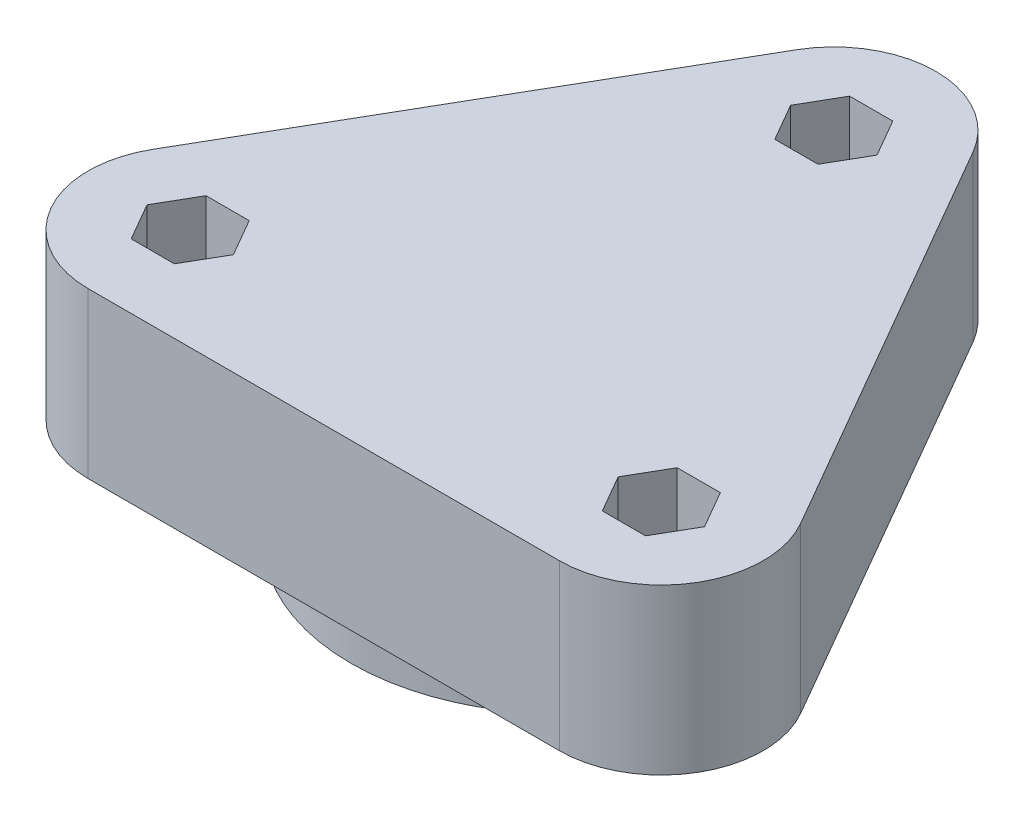
from build123d import *

# Parameters (mm, degrees)
ESQUISSE1_R             = 11.9
ESQUISSE1_R_2           = 2
BOSS_EXTRU_1_DEPTH      = 12
ENL_V_MAT_EXTRU_1_DEPTH = 5
SKETCH1_R               = 11.9
BOSS_EXTRUDE1_DEPTH     = 4
BOSS_EXTRUDE2_START     = 4.1
SKETCH2_R               = 15.5
SKETCH2_R_2             = 11.9
BOSS_EXTRUDE2_DEPTH     = 4.1
BOSS_EXTRUDE3_DEPTH     = 0.1


with BuildPart() as part:
    # Esquisse1 → Boss.-Extru.1 (new body)
    with BuildSketch(Plane(origin=(0, 0, 0), x_dir=(1, 0, 0), z_dir=(0, 1, 0))):
        with BuildLine():
            Line((-6.495190528, 23.75), (-23.815698604, -6.25))
            ThreePointArc((-23.815698604, -6.25), (-23.815698604, -13.75), (-17.320508076, -17.5))
            Line((-17.320508076, -17.5), (17.320508076, -17.5))
            ThreePointArc((17.320508076, -17.5), (23.815698604, -13.75), (23.815698604, -6.25))
            Line((23.815698604, -6.25), (6.495190528, 23.75))
            ThreePointArc((6.495190528, 23.75), (0, 27.5), (-6.495190528, 23.75))
        make_face()
        Circle(ESQUISSE1_R, mode=Mode.SUBTRACT)
        with Locations((-17.320508076, -10)):
            Circle(ESQUISSE1_R_2, mode=Mode.SUBTRACT)
        with Locations((0, 20)):
            Circle(ESQUISSE1_R_2, mode=Mode.SUBTRACT)
        with Locations((17.320508076, -10)):
            Circle(ESQUISSE1_R_2, mode=Mode.SUBTRACT)
    extrude(amount=BOSS_EXTRU_1_DEPTH)

    # Esquisse2 → Enlèv. mat.-Extru.1 (cut)
    with BuildSketch(Plane(origin=(0, 12, 0), x_dir=(1, 0, 0), z_dir=(0, 1, 0))):
        Polygon((-18.908221316, -7.25), (-20.495934556, -10), (-18.908221316, -12.75), (-15.732794835, -12.75), (-14.145081595, -10), (-15.732794835, -7.25), align=None)
        Polygon((-1.58771324, 22.75), (-3.175426481, 20), (-1.58771324, 17.25), (1.58771324, 17.25), (3.175426481, 20), (1.58771324, 22.75), align=None)
        Polygon((18.908221316, -7.25), (15.732794835, -7.25), (14.145081595, -10), (15.732794835, -12.75), (18.908221316, -12.75), (20.495934556, -10), align=None)
    extrude(amount=-ENL_V_MAT_EXTRU_1_DEPTH, mode=Mode.SUBTRACT)

    # Sketch2 → Boss-Extrude2 (add)
    with BuildSketch(Plane.XZ.offset(BOSS_EXTRUDE2_START)):
        Circle(SKETCH2_R)
        Circle(SKETCH2_R_2, mode=Mode.SUBTRACT)
    extrude(amount=-BOSS_EXTRUDE2_DEPTH)



with BuildPart() as body_2:
    # Sketch1 → Boss-Extrude1 (new body)
    with BuildSketch(Plane(origin=(0, 12, 0), x_dir=(1, 0, 0), z_dir=(0, 1, 0))):
        Circle(SKETCH1_R)
    extrude(amount=-BOSS_EXTRUDE1_DEPTH)


with BuildPart() as part_1:
    add(part.part)

    add(body_2.part)  # Boss-Extrude3 merges body 2
    # Sketch3 → Boss-Extrude3 (add)
    with BuildSketch(Plane(origin=(0, 12, 0), x_dir=(1, 0, 0), z_dir=(0, 1, 0))):
        with BuildLine():
            Line((-6.495190528, 23.75), (-23.815698604, -6.25))
            ThreePointArc((-23.815698604, -6.25), (-23.815698604, -13.75), (-17.320508076, -17.5))
            Line((-17.320508076, -17.5), (17.320508076, -17.5))
            ThreePointArc((17.320508076, -17.5), (23.815698604, -13.75), (23.815698604, -6.25))
            Line((23.815698604, -6.25), (6.495190528, 23.75))
            ThreePointArc((6.495190528, 23.75), (0, 27.5), (-6.495190528, 23.75))
        make_face()
        Polygon((-1.58771324, 22.75), (-3.175426481, 20), (-1.58771324, 17.25), (1.58771324, 17.25), (3.175426481, 20), (1.58771324, 22.75), align=None, mode=Mode.SUBTRACT)
        Polygon((18.908221316, -12.75), (20.495934556, -10), (18.908221316, -7.25), (15.732794835, -7.25), (14.145081595, -10), (15.732794835, -12.75), align=None, mode=Mode.SUBTRACT)
        Polygon((-18.908221316, -7.25), (-20.495934556, -10), (-18.908221316, -12.75), (-15.732794835, -12.75), (-14.145081595, -10), (-15.732794835, -7.25), align=None, mode=Mode.SUBTRACT)
    extrude(amount=BOSS_EXTRUDE3_DEPTH)


solid = part_1.part
